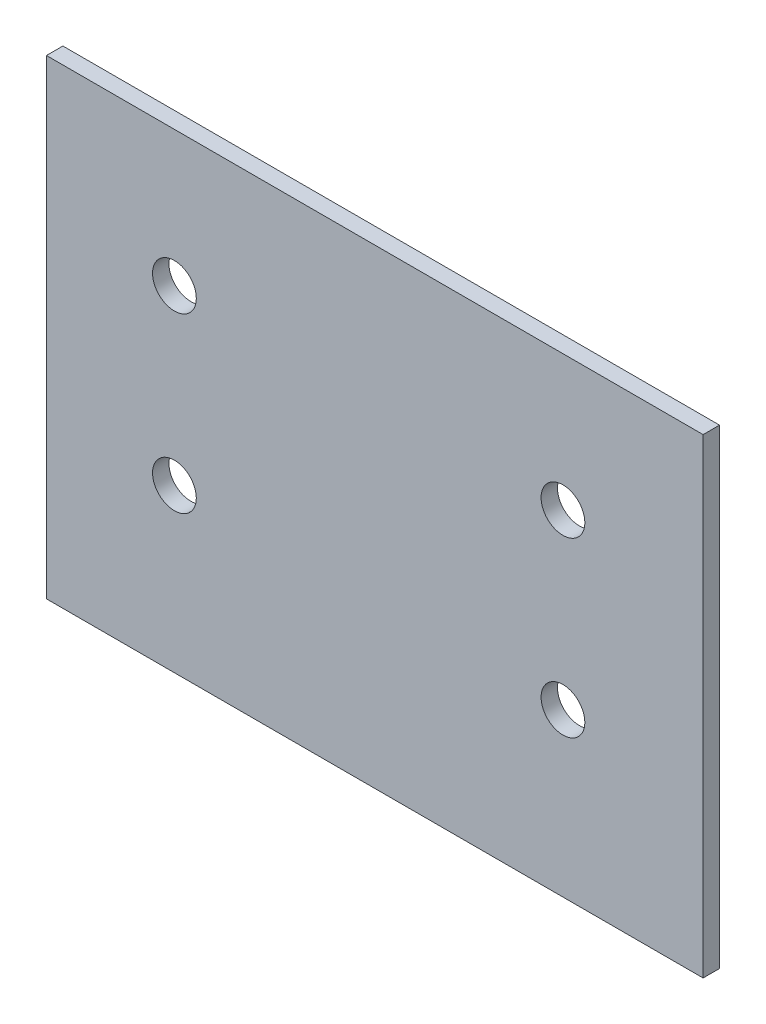
from build123d import *

# Parameters (mm, degrees)
SKETCH1_W           = 76.2
SKETCH1_H           = 54.61
BOSS_EXTRUDE1_DEPTH = 1.905
SKETCH2_R           = 2.54
CUT_EXTRUDE1_DEPTH  = 47.912706701


with BuildPart() as part:
    # Sketch1 → Boss-Extrude1 (new body)
    with BuildSketch(Plane.XY):
        Rectangle(SKETCH1_W, SKETCH1_H)
    extrude(amount=BOSS_EXTRUDE1_DEPTH)

    # Sketch2 → Cut-Extrude1 (cut, through all)
    with BuildSketch(Plane.XY.offset(1.905)):
        with Locations((-23.252519268, 11.583987587)):
            Circle(SKETCH2_R)
        with Locations((-23.252519268, -8.482012413)):
            Circle(SKETCH2_R)
        with Locations((21.834079799, 11.583987587)):
            Circle(SKETCH2_R)
        with Locations((21.834079799, -8.482012413)):
            Circle(SKETCH2_R)
    extrude(amount=-CUT_EXTRUDE1_DEPTH, mode=Mode.SUBTRACT)


solid = part.part
